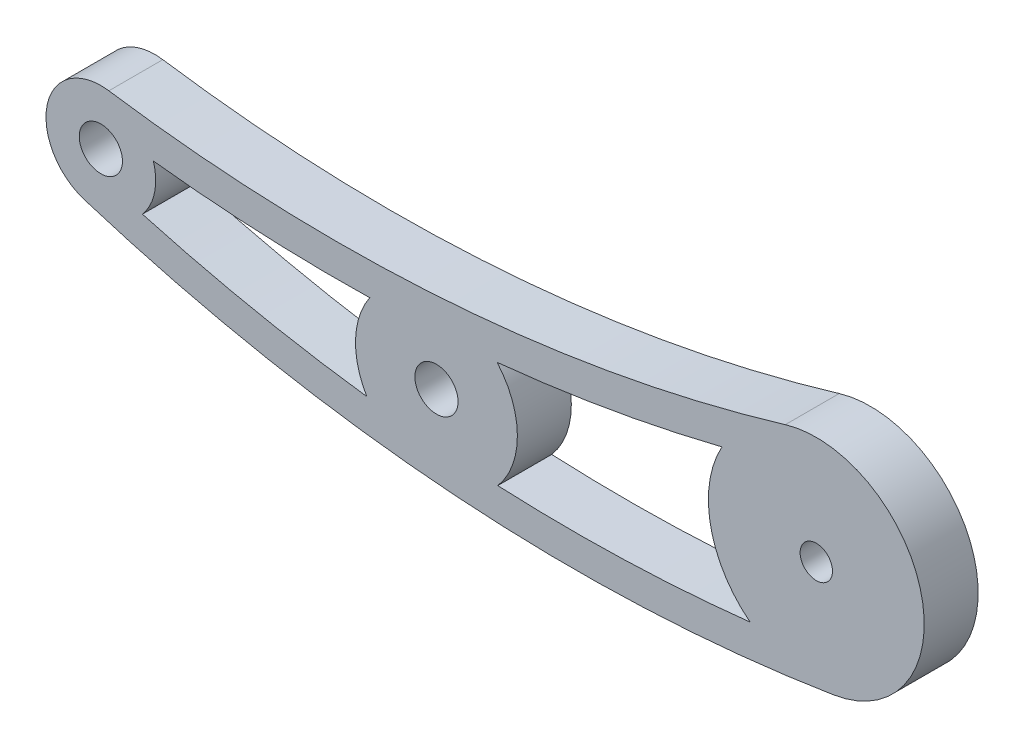
from build123d import *

# Parameters (mm, degrees)
SKETCH1_R           = 2
SKETCH1_R_2         = 1.5
EXTRUDE1_DEPTH      = 5
BOSS_EXTRUDE1_START = -5
SKETCH2_R           = 2
SKETCH2_R_2         = 1.5
BOSS_EXTRUDE1_DEPTH = 5
CUT_EXTRUDE1_START  = -5
CUT_EXTRUDE1_DEPTH  = 5


with BuildPart() as part:
    # Sketch1 → Extrude1 (new body)
    with BuildSketch(Plane.XY):
        with BuildLine():
            ThreePointArc((-2.193092226, -4.586072393), (33.15, -8), (68.493092226, -4.586072393))
            ThreePointArc((68.493092226, -4.586072393), (71.132119564, 1.578712775), (65.362424897, 4.996265248))
            ThreePointArc((65.362424897, 4.996265248), (33.150000007, 2), (0.937575117, 4.996265246))
            ThreePointArc((0.937575117, 4.996265246), (-4.832119562, 1.578712782), (-2.193092226, -4.586072393))
        make_face()
        Circle(SKETCH1_R, mode=Mode.SUBTRACT)
        with Locations((31.1, -3.74)):
            Circle(SKETCH1_R, mode=Mode.SUBTRACT)
        with Locations((66.3, 0)):
            Circle(SKETCH1_R_2, mode=Mode.SUBTRACT)
    extrude(amount=EXTRUDE1_DEPTH)

    # Sketch2 → Boss-Extrude1 (add)
    with BuildSketch(Plane.XY.offset(5).offset(BOSS_EXTRUDE1_START)):
        with BuildLine():
            ThreePointArc((-1.523614168, -4.849774569), (32.891650058, -11.40834478), (67.892593326, -9.872367826))
            ThreePointArc((67.892593326, -9.872367826), (76.046454518, 2.23754873), (63.427158085, 9.578453911))
            ThreePointArc((63.427158085, 9.578453911), (32.334608499, 3.858874967), (0.742030741, 5.029026137))
            ThreePointArc((0.742030741, 5.029026137), (-4.954835417, 1.136362396), (-1.523614168, -4.849774569))
        make_face()
        with Locations((31.1, -3.74)):
            Circle(SKETCH2_R, mode=Mode.SUBTRACT)
        Circle(SKETCH2_R, mode=Mode.SUBTRACT)
        with Locations((66.3, 0)):
            Circle(SKETCH2_R_2, mode=Mode.SUBTRACT)
    extrude(amount=BOSS_EXTRUDE1_DEPTH)

    # Sketch3 → Cut-Extrude1 (cut)
    with BuildSketch(Plane.XY.offset(5).offset(CUT_EXTRUDE1_START)):
        with BuildLine():
            ThreePointArc((4.86926369, 1.460131712), (4.972034413, -1.058577959), (3.852185168, -3.316984011))
            ThreePointArc((3.852185168, -3.316984011), (14.172697484, -5.810622174), (24.645226339, -7.559148726))
            ThreePointArc((24.645226339, -7.559148726), (23.604378321, -3.483766436), (24.921100593, 0.511023655))
            ThreePointArc((24.921100593, 0.511023655), (14.879037339, 0.644485923), (4.86926369, 1.460131712))
        make_face()
        with BuildLine():
            ThreePointArc((36.718188813, 1.228496198), (38.599846278, -3.691981225), (36.781348534, -8.636149389))
            ThreePointArc((36.781348534, -8.636149389), (48.487966367, -8.728733859), (60.165384794, -7.897246119))
            ThreePointArc((60.165384794, -7.897246119), (56.502324822, -2.001389793), (57.559699529, 4.858718728))
            ThreePointArc((57.559699529, 4.858718728), (47.20402982, 2.669943525), (36.718188813, 1.228496198))
        make_face()
    extrude(amount=CUT_EXTRUDE1_DEPTH, mode=Mode.SUBTRACT)


solid = part.part
